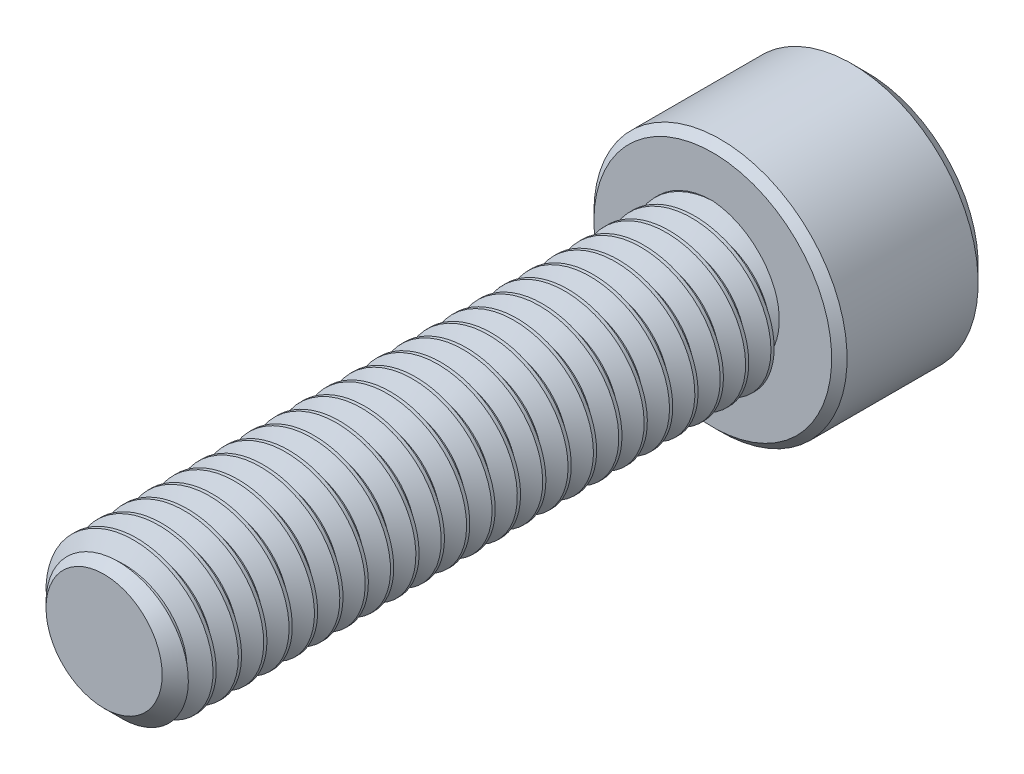
from build123d import *

# Parameters (mm, degrees)
SKETCH1_R          = 2.413
EXTRUDE1_DEPTH     = 19.05
CHAMFER3_SIZE      = 0.5953125
CUT_SWEEP1_PITCH   = 0.79375
SKETCH6_R          = 3.9624
EXTRUDE2_DEPTH     = 4.826
CUT_EXTRUDE1_DEPTH = 2.9765625
SKETCH8_R          = 2.291358881
CUT_EXTRUDE2_DEPTH = 0.4826
CUT_EXTRUDE2_DRAFT = -45
CHAMFER1_SIZE      = 0.4826
CHAMFER2_SIZE      = 0.2413


with BuildPart() as part:
    # Sketch1 → Extrude1 (new body)
    with BuildSketch(Plane.XY):
        Circle(SKETCH1_R)
    extrude(amount=-EXTRUDE1_DEPTH)

    # Chamfer3
    chamfer3_edges = [part.edges().sort_by_distance(p)[0] for p in [
        (-2.413, 0, 0),
    ]]
    chamfer(chamfer3_edges, length=CHAMFER3_SIZE)

    # Cut-Sweep1: the profile of Sketch3 profile screwed along a right-hand helix of 25 turns, 6 arcs to a turn; built about Z, then put on its axis
    cut_sweep1_z = Axis((0, 0, 0), (0, 0, 1))
    cut_sweep1_corners = [(2.4133, 0, -0.694704455), (1.897444252, 0, -0.396875), (1.897444252, 0, -0.29765625), (2.4133, 0, 0.000173205)]
    with BuildLine(mode=Mode.PRIVATE) as cut_sweep1_profile:
        Line(cut_sweep1_corners[0], cut_sweep1_corners[1])
        Line(cut_sweep1_corners[1], cut_sweep1_corners[2])
        Line(cut_sweep1_corners[2], cut_sweep1_corners[3])
        Line(cut_sweep1_corners[3], cut_sweep1_corners[0])
    cut_sweep1_cap = Face(cut_sweep1_profile.wire())
    cut_sweep1_turn_angles = [0, 30, 60, 90, 120, 150, 180, 210, 240, 270, 300, 330, 360]
    cut_sweep1_turn_weights = [1, 0.8660254037844387, 1, 0.8660254037844387, 1, 0.8660254037844387, 1, 0.8660254037844387, 1, 0.8660254037844387, 1, 0.8660254037844387, 1]
    cut_sweep1_turn_rails = [Edge.make_bspline([Vector(p[0], p[1], 0).rotate(cut_sweep1_z, cut_sweep1_turn_angles[k]) / cut_sweep1_turn_weights[k] + Vector(0, 0, p[2] + CUT_SWEEP1_PITCH * cut_sweep1_turn_angles[k] / 360) for k in range(13)], [0, 0, 0, 1, 1, 2, 2, 3, 3, 4, 4, 5, 5, 6, 6, 6], 2, cut_sweep1_turn_weights) for p in cut_sweep1_corners]
    cut_sweep1_turn_sides = [Face.make_surface_from_curves(cut_sweep1_turn_rails[p[0]], cut_sweep1_turn_rails[p[1]]) for p in [(0, 1), (1, 2), (2, 3), (3, 0)]]
    cut_sweep1 = Plane(origin=(0, 0, 0), x_dir=(0, 1, 0), z_dir=(0, 0, -1)) * Solid(Shell([*[p.moved(Location((0, 0, CUT_SWEEP1_PITCH * i))) for i in range(25) for p in cut_sweep1_turn_sides], cut_sweep1_cap, cut_sweep1_cap.rotate(cut_sweep1_z, 9000).moved(Location((0, 0, CUT_SWEEP1_PITCH * 9000 / 360)))]))
    add(cut_sweep1, mode=Mode.SUBTRACT)

    # Sketch6 → Extrude2 (add)
    with BuildSketch(Plane(origin=(0, 0, -19.05), x_dir=(-1, 0, 0), z_dir=(0, 0, -1))):
        Circle(SKETCH6_R)
    extrude(amount=EXTRUDE2_DEPTH)

    # Sketch7 → Cut-Extrude1 (cut)
    with BuildSketch(Plane(origin=(0, 0, -23.876), x_dir=(-1, 0, 0), z_dir=(0, 0, -1))):
        Polygon((0, 2.291358881), (-1.984375, 1.14567944), (-1.984375, -1.14567944), (0, -2.291358881), (1.984375, -1.14567944), (1.984375, 1.14567944), align=None)
    extrude(amount=-CUT_EXTRUDE1_DEPTH, mode=Mode.SUBTRACT)


with BuildPart() as cut_extrude2_tool:
    # Sketch8 → Cut-Extrude2 (with draft: the straight prism first)
    with BuildSketch(Plane(origin=(0, 0, -23.876), x_dir=(-1, 0, 0), z_dir=(0, 0, -1))):
        Circle(SKETCH8_R)
    extrude(amount=-CUT_EXTRUDE2_DEPTH)
    # Cut-Extrude2: the draft: its side faces are tilted about the plane it starts from
    cut_extrude2_sides = [cut_extrude2_tool.faces().sort_by_distance(p)[0] for p in [
        (2.291358881, 0, -23.6347),
    ]]
    draft(cut_extrude2_sides, Plane(origin=(0, 0, -23.876), x_dir=(-1, 0, 0), z_dir=(0, 0, -1)), CUT_EXTRUDE2_DRAFT)


with BuildPart() as part_1:
    add(part.part)

    # Cut-Extrude2: cut by cut_extrude2_tool
    add(cut_extrude2_tool.part, mode=Mode.SUBTRACT)

    # Chamfer1
    chamfer1_edges = [part_1.edges().sort_by_distance(p)[0] for p in [
        (3.9624, 0, -23.876),
    ]]
    chamfer(chamfer1_edges, length=CHAMFER1_SIZE)

    # Chamfer2
    chamfer2_edges = [part_1.edges().sort_by_distance(p)[0] for p in [
        (3.9624, 0, -19.05),
    ]]
    chamfer(chamfer2_edges, length=CHAMFER2_SIZE)


solid = part_1.part
